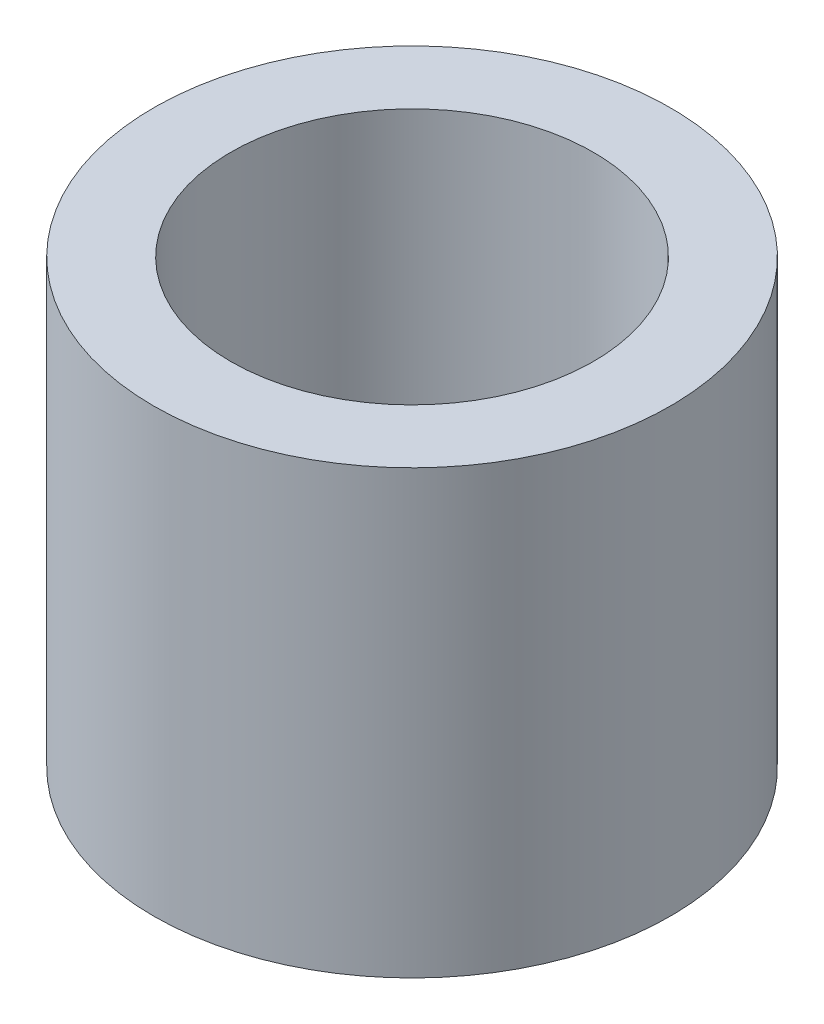
from build123d import *

# Parameters (mm, degrees)
SKETCH1_R           = 22.5
BOSS_EXTRUDE1_DEPTH = 38.47869914
SKETCH2_R           = 15.791420021
CUT_EXTRUDE1_DEPTH  = 50.931055341


with BuildPart() as part:
    # Sketch1 → Boss-Extrude1 (new body)
    with BuildSketch(Plane(origin=(0, 0, 0), x_dir=(1, 0, 0), z_dir=(0, 1, 0))):
        Circle(SKETCH1_R)
    extrude(amount=BOSS_EXTRUDE1_DEPTH)

    # Sketch2 → Cut-Extrude1 (cut, through all)
    with BuildSketch(Plane(origin=(0, 0, 0), x_dir=(1, 0, 0), z_dir=(0, 1, 0))):
        Circle(SKETCH2_R)
    extrude(amount=CUT_EXTRUDE1_DEPTH, mode=Mode.SUBTRACT)


solid = part.part
